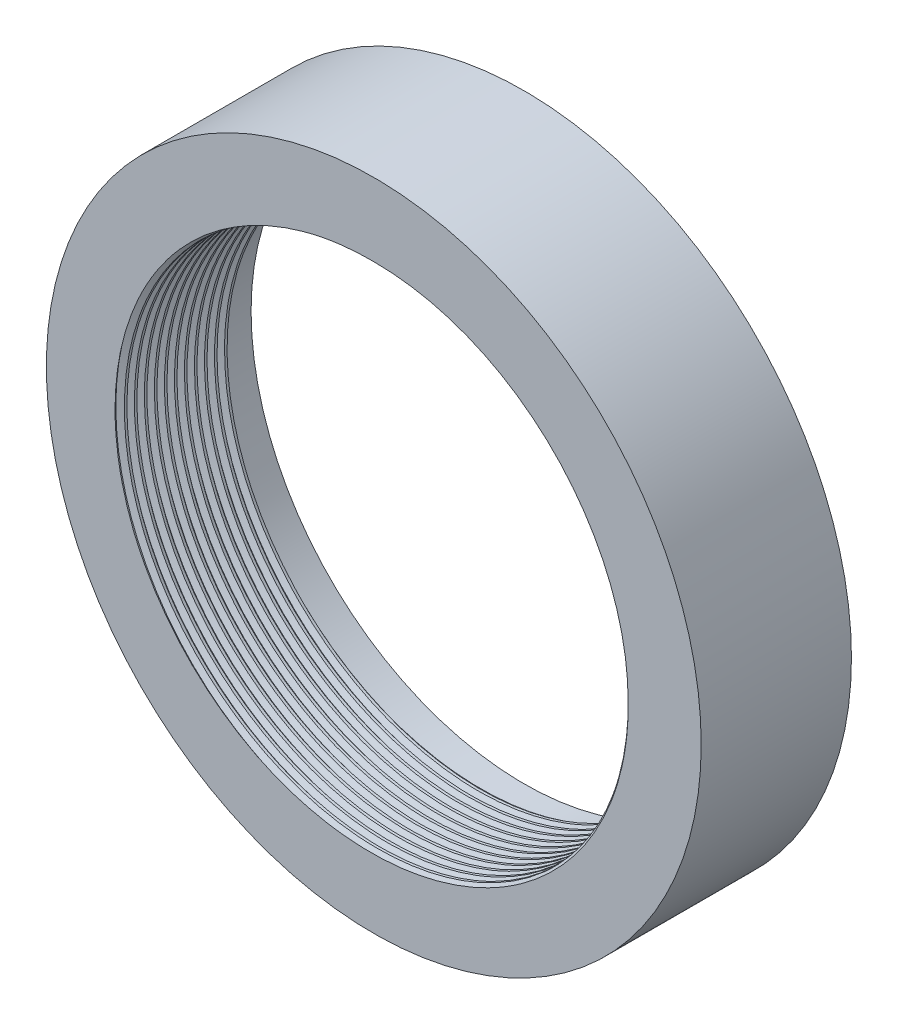
from build123d import *

# Parameters (mm, degrees)
SKETCH_1_R          = 32.69
EXTRUDE_1_DEPTH     = 15
CUT_EXTRUDE_1_REACH = 50.603
SKETCH_2_R          = 25.4
THREAD_1_PITCH      = 1
SKETCH_3_R          = 27.25
CUT_EXTRUDE_2_DEPTH = 4


with BuildPart() as part:
    # Sketch 1 → 凸台-拉伸1 (new body)
    with BuildSketch(Plane.XY):
        Circle(SKETCH_1_R)
    extrude(amount=EXTRUDE_1_DEPTH)

    # 草图2 → 切除-拉伸1 (cut, up to next)
    with BuildSketch(Plane(origin=(0, 0, 0), x_dir=(-1, 0, 0), z_dir=(0, 0, -1)), mode=Mode.PRIVATE) as cut_extrude_1_sk1:
        Circle(SKETCH_2_R)
    cut_extrude_1_tool1 = extrude(cut_extrude_1_sk1.sketch, amount=-CUT_EXTRUDE_1_REACH, mode=Mode.PRIVATE) & part.part
    add(cut_extrude_1_tool1.solids().sort_by_distance((0, 0, 0))[0], mode=Mode.SUBTRACT)

    # 螺纹线1: the profile of Sketch 1 2 profile screwed along a right-hand helix of 15 turns, 8 arcs to a turn; built about Z, then put on its axis
    thread_1_z = Axis((0, 0, 0), (0, 0, 1))
    thread_1_corners = [(25.3997, 0, -0.000173205), (25.941265875, 0, 0.312499999), (25.941265875, 0, 0.437499999), (25.3997, 0, 0.750173202)]
    with BuildLine(mode=Mode.PRIVATE) as thread_1_profile:
        Line(thread_1_corners[0], thread_1_corners[1])
        Line(thread_1_corners[1], thread_1_corners[2])
        Line(thread_1_corners[2], thread_1_corners[3])
        Line(thread_1_corners[3], thread_1_corners[0])
    thread_1_cap = Face(thread_1_profile.wire())
    thread_1_turn_angles = [0, 22.5, 45, 67.5, 90, 112.5, 135, 157.5, 180, 202.5, 225, 247.5, 270, 292.5, 315, 337.5, 360]
    thread_1_turn_weights = [1, 0.9238795325112867, 1, 0.9238795325112867, 1, 0.9238795325112867, 1, 0.9238795325112867, 1, 0.9238795325112867, 1, 0.9238795325112867, 1, 0.9238795325112867, 1, 0.9238795325112867, 1]
    thread_1_turn_rails = [Edge.make_bspline([Vector(p[0], p[1], 0).rotate(thread_1_z, thread_1_turn_angles[k]) / thread_1_turn_weights[k] + Vector(0, 0, p[2] + THREAD_1_PITCH * thread_1_turn_angles[k] / 360) for k in range(17)], [0, 0, 0, 1, 1, 2, 2, 3, 3, 4, 4, 5, 5, 6, 6, 7, 7, 8, 8, 8], 2, thread_1_turn_weights) for p in thread_1_corners]
    thread_1_turn_sides = [Face.make_surface_from_curves(thread_1_turn_rails[p[0]], thread_1_turn_rails[p[1]]) for p in [(0, 1), (1, 2), (2, 3), (3, 0)]]
    thread_1 = Plane(origin=(0, 0, 0), x_dir=(1, 0, 0), z_dir=(0, 0, 1)) * Solid(Shell([*[p.moved(Location((0, 0, THREAD_1_PITCH * i))) for i in range(15) for p in thread_1_turn_sides], thread_1_cap, thread_1_cap.rotate(thread_1_z, 5400).moved(Location((0, 0, THREAD_1_PITCH * 5400 / 360)))]))
    add(thread_1, mode=Mode.SUBTRACT)

    # 草图3 → 切除-拉伸2 (cut)
    with BuildSketch(Plane(origin=(0, 0, 0), x_dir=(-1, 0, 0), z_dir=(0, 0, -1))):
        Circle(SKETCH_3_R)
    extrude(amount=-CUT_EXTRUDE_2_DEPTH, mode=Mode.SUBTRACT)


solid = part.part
